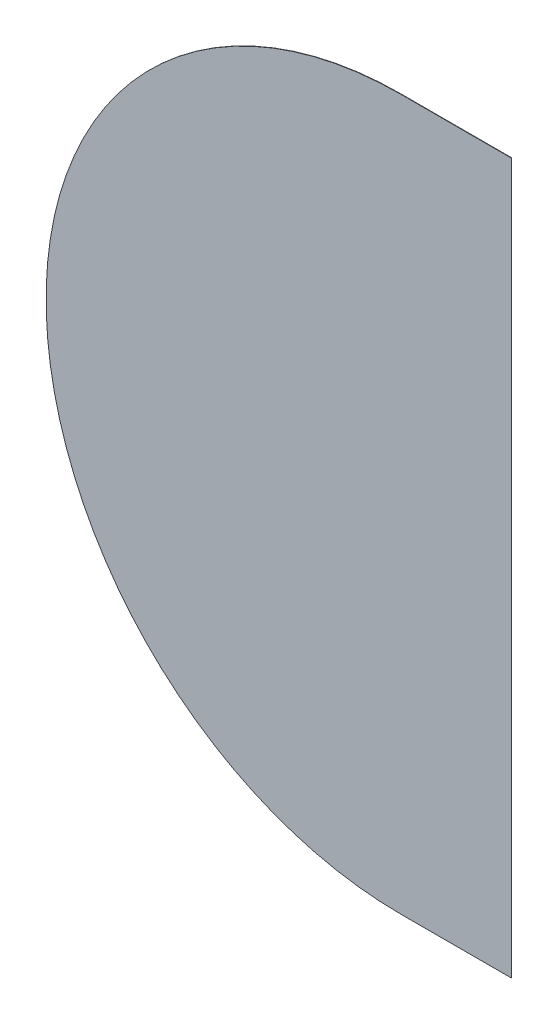
from build123d import *

# Parameters (mm, degrees)
BOSS_EXTRUDE1_DEPTH = 1


with BuildPart() as part:
    # Sketch1 → Boss-Extrude1 (new body)
    with BuildSketch(Plane.XY):
        with BuildLine():
            Line((0, 0), (270, 0))
            Line((270, 0), (270, 1740))
            Line((270, 1740), (0, 1740))
            ThreePointArc((0, 1740), (-870, 870), (0, 0))
        make_face()
    extrude(amount=BOSS_EXTRUDE1_DEPTH)


solid = part.part
